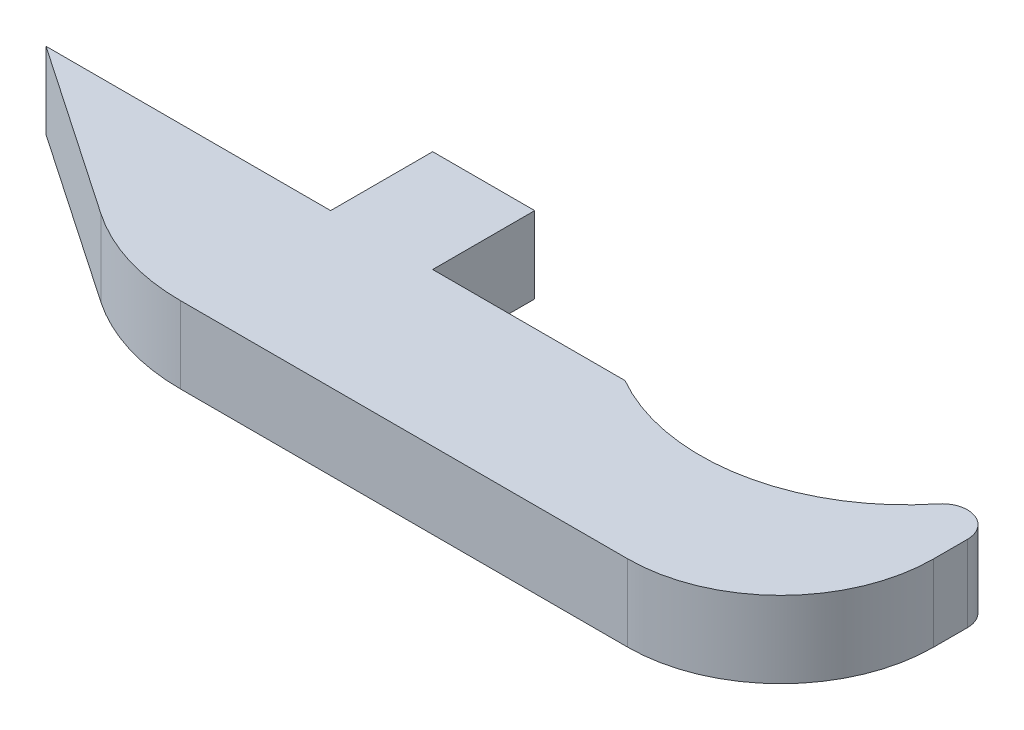
from build123d import *

# Parameters (mm, degrees)
BOSS_EXTRUDE1_DEPTH = 4.7625
FILLET1_R           = 9.525
FILLET2_R           = 1.5875
FILLET4_R           = 12.7
BOSS_EXTRUDE2_DEPTH = 4.7625


with BuildPart() as part:
    # Sketch1 → Boss-Extrude1 (new body)
    with BuildSketch(Plane(origin=(0, 0, 0), x_dir=(1, 0, 0), z_dir=(0, 1, 0))):
        with BuildLine():
            ThreePointArc((58.41999999999972, 11.1252), (52.02098311010975, 0.02506657124609291), (39.20849892630516, 3.1797e-13))
            Line((39.20849892630509, 3.04e-15), (3.17499999999972, 1.84e-15))
            Line((3.174999999999723, -3.02e-15), (17.14499999999994, -9.525))
            Line((17.14499999999994, -9.525), (58.41999999999994, -9.525))
            Line((58.41999999999994, -9.525000000000002), (58.419999999999725, 11.125200000000003))
        make_face()
    extrude(amount=BOSS_EXTRUDE1_DEPTH)

    # Fillet1
    fillet1_edges = [part.edges().sort_by_distance(p)[0] for p in [
        (58.41999999999994, 2.38125, 9.525000000000002),
    ]]
    fillet(fillet1_edges, radius=FILLET1_R)

    # Fillet2
    fillet2_edges = [part.edges().sort_by_distance(p)[0] for p in [
        (58.41999999999972, 2.38125, -11.125200000000001),
    ]]
    fillet(fillet2_edges, radius=FILLET2_R)

    # Fillet4
    fillet4_edges = [part.edges().sort_by_distance(p)[0] for p in [
        (17.14499999999994, 2.38125, 9.525),
    ]]
    fillet(fillet4_edges, radius=FILLET4_R)

    # Sketch2 → Boss-Extrude2 (add)
    with BuildSketch(Plane.XZ):
        Polygon((20.889500000000094, -6.349999999999998), (27.239500000000092, -6.349999999999998), (27.239500000000096, 5.33e-15), (20.889500000000094, 4.43e-15), align=None)
    extrude(amount=-BOSS_EXTRUDE2_DEPTH)


solid = part.part
